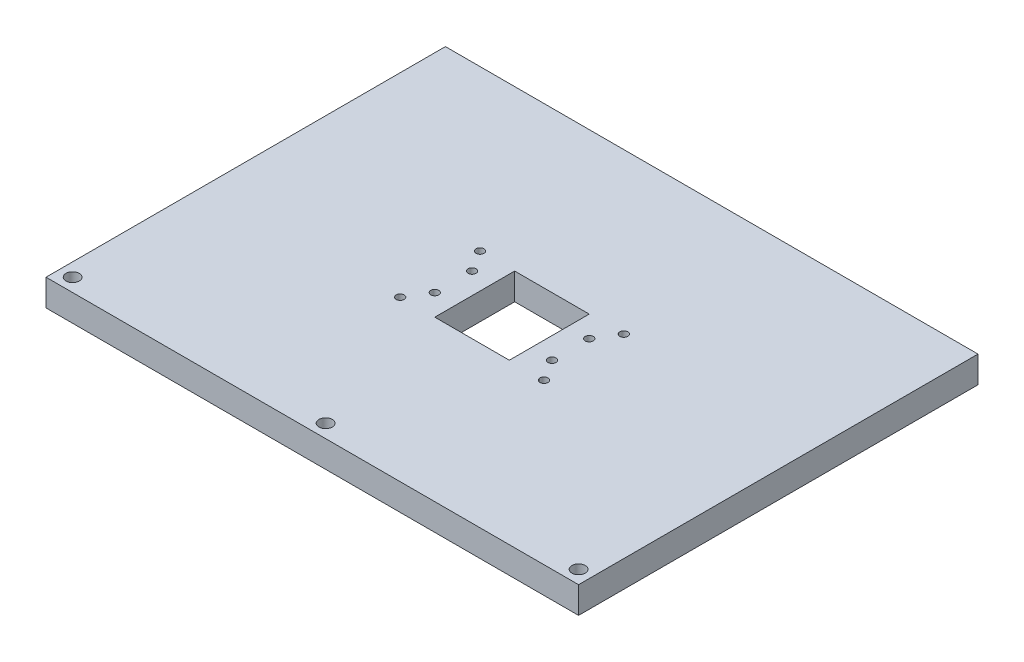
from build123d import *

# Parameters (mm, degrees)
SKETCH1_W           = 200
SKETCH1_H           = 60
BOSS_EXTRUDE1_DEPTH = 10
SKETCH2_W           = 200
SKETCH2_H           = 10
BOSS_EXTRUDE2_DEPTH = 140
SKETCH3_R           = 15.5
CUT_EXTRUDE1_DEPTH  = 60
SKETCH7_W           = 10
SKETCH7_H           = 30
CUT_EXTRUDE4_DEPTH  = 30
SKETCH9_R           = 1.5
SKETCH9_R_2         = 2.5
CUT_EXTRUDE6_DEPTH  = 20
SKETCH10_W          = 33.76561095
SKETCH10_H          = 62.627783557
CUT_EXTRUDE7_DEPTH  = 130
SKETCH11_W          = 8
SKETCH11_H          = 30
CUT_EXTRUDE8_DEPTH  = 30


with BuildPart() as part:
    # Sketch1 → Boss-Extrude1 (new body)
    with BuildSketch(Plane.XY):
        Rectangle(SKETCH1_W, SKETCH1_H)
    extrude(amount=BOSS_EXTRUDE1_DEPTH)

    # Sketch2 → Boss-Extrude2 (add)
    with BuildSketch(Plane(origin=(0, 0, 0), x_dir=(-1, 0, 0), z_dir=(0, 0, -1))):
        with Locations((0, -25)):
            Rectangle(SKETCH2_W, SKETCH2_H)
    extrude(amount=BOSS_EXTRUDE2_DEPTH)

    # Sketch3 → Cut-Extrude1 (cut)
    with BuildSketch(Plane.XY.offset(10)):
        with Locations((0, 5)):
            Circle(SKETCH3_R)
        with Locations((60, 5)):
            Circle(SKETCH3_R)
        with Locations((-60, 5)):
            Circle(SKETCH3_R)
    extrude(amount=-CUT_EXTRUDE1_DEPTH, mode=Mode.SUBTRACT)

    # Sketch7 → Cut-Extrude4 (cut)
    with BuildSketch(Plane(origin=(0, -20, 0), x_dir=(1, 0, 0), z_dir=(0, 1, 0))):
        with Locations((9, 65)):
            Rectangle(SKETCH7_W, SKETCH7_H)
        with Locations((-9, 65)):
            Rectangle(SKETCH7_W, SKETCH7_H)
    extrude(amount=-CUT_EXTRUDE4_DEPTH, mode=Mode.SUBTRACT)

    # Sketch9 → Cut-Extrude6 (cut)
    with BuildSketch(Plane(origin=(0, -20, 0), x_dir=(1, 0, 0), z_dir=(0, 1, 0))):
        with Locations((-27, 80)):
            Circle(SKETCH9_R)
        with Locations((27, 80)):
            Circle(SKETCH9_R)
        with Locations((27, 50)):
            Circle(SKETCH9_R)
        with Locations((-27, 50)):
            Circle(SKETCH9_R)
        with Locations((-22, 72)):
            Circle(SKETCH9_R)
        with Locations((-22, 58)):
            Circle(SKETCH9_R)
        with Locations((22, 72)):
            Circle(SKETCH9_R)
        with Locations((22, 58)):
            Circle(SKETCH9_R)
        with Locations((0, -5)):
            Circle(SKETCH9_R_2)
        with Locations((95, -5)):
            Circle(SKETCH9_R_2)
        with Locations((-95, -5)):
            Circle(SKETCH9_R_2)
    extrude(amount=-CUT_EXTRUDE6_DEPTH, mode=Mode.SUBTRACT)

    # Sketch10 → Cut-Extrude7 (cut, symmetric)
    with BuildSketch(Plane(origin=(0, 0, 0), x_dir=(0, 0, -1), z_dir=(1, 0, 0))):
        with Locations((-16.882805475, 11.313891779)):
            Rectangle(SKETCH10_W, SKETCH10_H)
    extrude(amount=CUT_EXTRUDE7_DEPTH, both=True, mode=Mode.SUBTRACT)

    # Sketch11 → Cut-Extrude8 (cut)
    with BuildSketch(Plane(origin=(0, -20, 0), x_dir=(1, 0, 0), z_dir=(0, 1, 0))):
        with Locations((0, 65)):
            Rectangle(SKETCH11_W, SKETCH11_H)
    extrude(amount=-CUT_EXTRUDE8_DEPTH, mode=Mode.SUBTRACT)


solid = part.part
